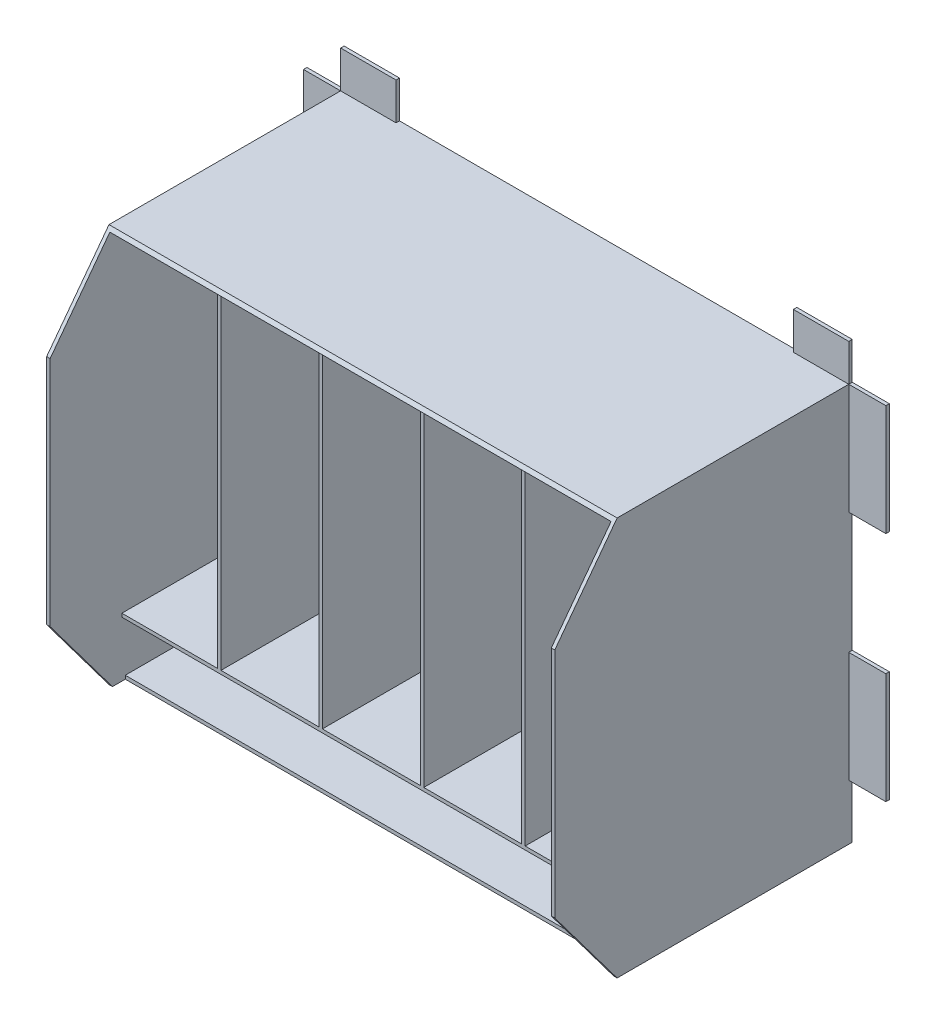
from build123d import *

# Parameters (mm, degrees)
SKETCH1_W           = 465.838
SKETCH1_H           = 365.232
BOSS_EXTRUDE1_DEPTH = 3.175
SKETCH2_W           = 465.838
SKETCH2_H           = 365.232
SKETCH2_W_2         = 89.789
SKETCH2_H_2         = 308.082
SKETCH2_W_3         = 87.632
SKETCH2_W_4         = 459.488
SKETCH2_H_3         = 47.625
BOSS_EXTRUDE2_DEPTH = 200.6
SKETCH5_W           = 89.789
SKETCH5_H           = 308.082
SKETCH5_W_2         = 87.632
BOSS_EXTRUDE5_DEPTH = 38.1
CUT_EXTRUDE2_DEPTH  = 35
BOSS_EXTRUDE6_DEPTH = 30.8
CUT_EXTRUDE3_DEPTH  = 579.469838561
SKETCH10_W          = 34.036
SKETCH10_H          = 101.6
SKETCH10_W_2        = 50.8
SKETCH10_H_2        = 34.036
BOSS_EXTRUDE7_DEPTH = 3.175


with BuildPart() as part:
    # Sketch1 → Boss-Extrude1 (new body)
    with BuildSketch(Plane.XY):
        with Locations((-46.4825, -25.4)):
            Rectangle(SKETCH1_W, SKETCH1_H)
    extrude(amount=BOSS_EXTRUDE1_DEPTH)

    # Sketch2 → Boss-Extrude2 (add)
    with BuildSketch(Plane.XY.offset(3.175)):
        with Locations((-46.4825, -25.4)):
            Rectangle(SKETCH2_W, SKETCH2_H)
        with Locations((138.367, 0)):
            Rectangle(SKETCH2_W_2, SKETCH2_H_2, mode=Mode.SUBTRACT)
        with Locations((45.403, 0)):
            Rectangle(SKETCH2_W_2, SKETCH2_H_2, mode=Mode.SUBTRACT)
        with Locations((-47.561, 0)):
            Rectangle(SKETCH2_W_2, SKETCH2_H_2, mode=Mode.SUBTRACT)
        with Locations((-140.525, 0)):
            Rectangle(SKETCH2_W_2, SKETCH2_H_2, mode=Mode.SUBTRACT)
        with Locations((-232.4105, 0)):
            Rectangle(SKETCH2_W_3, SKETCH2_H_2, mode=Mode.SUBTRACT)
        with Locations((-46.4825, -181.0285)):
            Rectangle(SKETCH2_W_4, SKETCH2_H_3, mode=Mode.SUBTRACT)
    extrude(amount=BOSS_EXTRUDE2_DEPTH)

    # Sketch5 → Boss-Extrude5 (add)
    with BuildSketch(Plane.XY.offset(203.775)):
        Polygon((186.4365, 157.216), (-279.4015, 157.216), (-279.4015, -208.016), (-276.2265, -208.016), (-276.2265, -157.216), (183.2615, -157.216), (183.2615, -208.016), (186.4365, -208.016), align=None)
        with Locations((-140.525, 0)):
            Rectangle(SKETCH5_W, SKETCH5_H, mode=Mode.SUBTRACT)
        with Locations((-47.561, 0)):
            Rectangle(SKETCH5_W, SKETCH5_H, mode=Mode.SUBTRACT)
        with Locations((45.403, 0)):
            Rectangle(SKETCH5_W, SKETCH5_H, mode=Mode.SUBTRACT)
        with Locations((138.367, 0)):
            Rectangle(SKETCH5_W, SKETCH5_H, mode=Mode.SUBTRACT)
        with Locations((-232.4105, 0)):
            Rectangle(SKETCH5_W_2, SKETCH5_H, mode=Mode.SUBTRACT)
    extrude(amount=BOSS_EXTRUDE5_DEPTH)

    # Sketch7 → Cut-Extrude2 (cut)
    with BuildSketch(Plane.XY.offset(241.875)):
        Polygon((-95.6305, -154.041), (-185.4195, -154.041), (-185.4195, 154.041), (-188.5945, 154.041), (-188.5945, -154.041), (-276.2265, -154.041), (-276.2265, -157.216), (183.2615, -157.216), (183.2615, -154.041), (93.4725, -154.041), (93.4725, 154.041), (90.2975, 154.041), (90.2975, -154.041), (0.5085, -154.041), (0.5085, 154.041), (-2.6665, 154.041), (-2.6665, -154.041), (-92.4555, -154.041), (-92.4555, 154.041), (-95.6305, 154.041), align=None)
    extrude(amount=-CUT_EXTRUDE2_DEPTH, mode=Mode.SUBTRACT)

    # Sketch8 → Boss-Extrude6 (add)
    with BuildSketch(Plane.XY.offset(241.875)):
        Polygon((183.2615, 154.041), (183.2615, -208.016), (186.4365, -208.016), (186.4365, 157.216), (-279.4015, 157.216), (-279.4015, -208.016), (-276.2265, -208.016), (-276.2265, 154.041), align=None)
    extrude(amount=BOSS_EXTRUDE6_DEPTH)

    # Sketch9 → Cut-Extrude3 (cut, through all)
    with BuildSketch(Plane(origin=(186.4365, 0, 0), x_dir=(0, 0, -1), z_dir=(1, 0, 0))):
        Polygon((-272.675, -208.016), (-215.525, -208.016), (-272.675, -131.816), align=None)
        Polygon((-272.675, 157.216), (-272.675, 81.016), (-215.525, 157.216), align=None)
    extrude(amount=-CUT_EXTRUDE3_DEPTH, mode=Mode.SUBTRACT)

    # Sketch10 → Boss-Extrude7 (add)
    with BuildSketch(Plane.XY):
        with Locations((203.4545, 106.416)):
            Rectangle(SKETCH10_W, SKETCH10_H)
        with Locations((161.0365, 174.234)):
            Rectangle(SKETCH10_W_2, SKETCH10_H_2)
        with Locations((203.4545, -106.416)):
            Rectangle(SKETCH10_W, SKETCH10_H)
    boss_extrude7 = extrude(amount=BOSS_EXTRUDE7_DEPTH)

    # Mirror1: Boss-Extrude7 across plane
    add(boss_extrude7.mirror(Plane.ZY.offset(46.4825)))


solid = part.part
